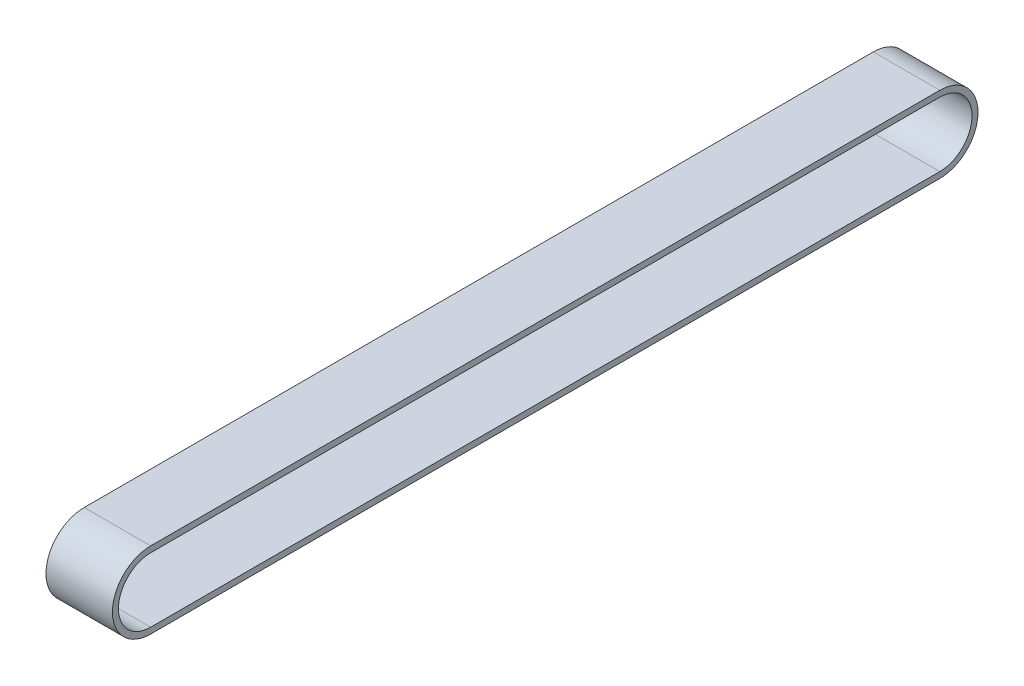
from build123d import *

# Parameters (mm, degrees)
BOSS_EXTRUDE1_DEPTH = 12.7


with BuildPart() as part:
    # Sketch1 → Boss-Extrude1 (new, symmetric)
    with BuildSketch(Plane(origin=(0, 0, 0), x_dir=(0, 0, -1), z_dir=(1, 0, 0))):
        with BuildLine():
            Line((-150.8125, 14.605), (150.8125, 14.605))
            ThreePointArc((150.8125, 14.605), (165.4175, 0), (150.8125, -14.605))
            Line((150.8125, -14.605), (-150.8125, -14.605))
            ThreePointArc((-150.8125, -14.605), (-165.4175, 0), (-150.8125, 14.605))
        make_face()
        with BuildLine():
            Line((-150.8125, 12.319), (150.8125, 12.319))
            ThreePointArc((150.8125, 12.319), (163.1315, 0), (150.8125, -12.319))
            Line((150.8125, -12.319), (-150.8125, -12.319))
            ThreePointArc((-150.8125, -12.319), (-163.1315, 0), (-150.8125, 12.319))
        make_face(mode=Mode.SUBTRACT)
    extrude(amount=BOSS_EXTRUDE1_DEPTH, both=True)


solid = part.part
